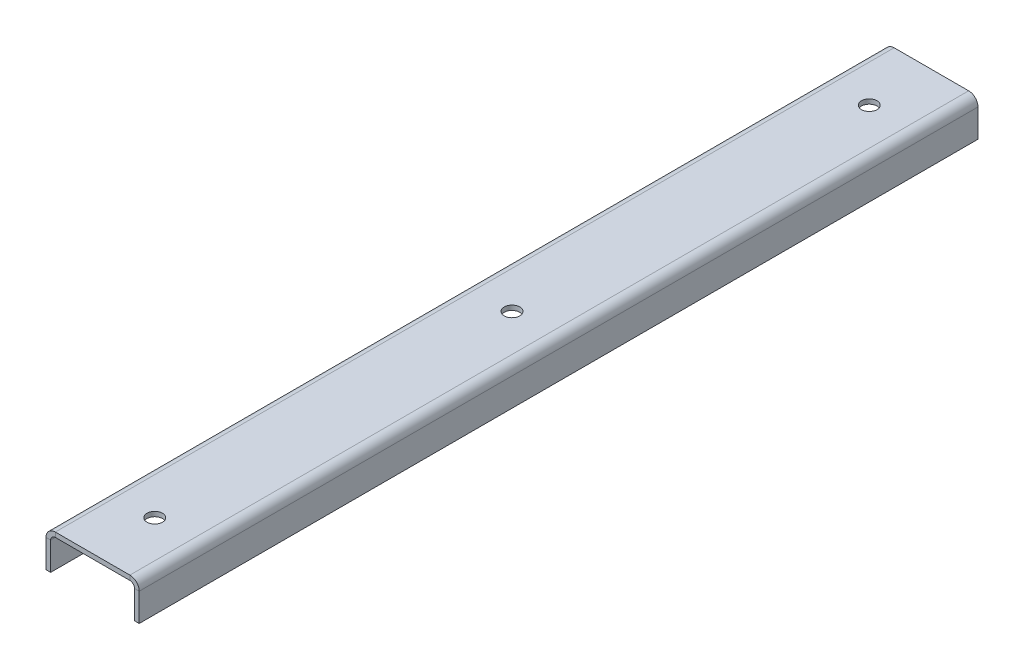
from build123d import *

# Parameters (mm, degrees)
SM_BASE_FLANGE_1_DEPTH = 135
SKETCH_2_R             = 2.5
CUT_EXTRUDE_1_DEPTH    = 10


# Sheet-metal steps are written as plain solids
with BuildPart() as part:
    # Sketch 1 → Базовая кромка1 (new, symmetric)
    with BuildSketch(Plane.XY):
        with BuildLine():
            Line((-13.5, -10.5), (-13.5, -1.5))
            ThreePointArc((-13.5, -1.5), (-13.060660172, -0.439339828), (-12, 0))
            Line((-12, 0), (12, 0))
            ThreePointArc((12, 0), (13.060660172, -0.439339828), (13.5, -1.5))
            Line((13.5, -1.5), (13.5, -10.5))
            Line((13.5, -10.5), (15, -10.5))
            Line((15, -10.5), (15, -1.5))
            ThreePointArc((15, -1.5), (14.121320344, 0.621320344), (12, 1.5))
            Line((12, 1.5), (-12, 1.5))
            ThreePointArc((-12, 1.5), (-14.121320344, 0.621320344), (-15, -1.5))
            Line((-15, -1.5), (-15, -10.5))
            Line((-15, -10.5), (-13.5, -10.5))
        make_face()
    extrude(amount=SM_BASE_FLANGE_1_DEPTH, both=True)

    # Sketch 2 → Вырез-Вытянуть1 (cut)
    with BuildSketch(Plane(origin=(0, 1.5, 0), x_dir=(1, 0, 0), z_dir=(0, 1, 0))):
        with Locations(Location((0, 0, 0), (0, 0, 180))):
            Circle(SKETCH_2_R)
        with Locations((0, 460)):
            Circle(SKETCH_2_R)
        with Locations(Location((0, -115, 0), (0, 0, 180))):
            Circle(SKETCH_2_R)
        with Locations((0, -230)):
            Circle(SKETCH_2_R)
        with Locations((0, -345)):
            Circle(SKETCH_2_R)
        with Locations((0, -460)):
            Circle(SKETCH_2_R)
        with Locations(Location((0, 115, 0), (0, 0, 180))):
            Circle(SKETCH_2_R)
        with Locations((0, 230)):
            Circle(SKETCH_2_R)
        with Locations((0, 345)):
            Circle(SKETCH_2_R)
    extrude(amount=-CUT_EXTRUDE_1_DEPTH, mode=Mode.SUBTRACT)


solid = part.part
